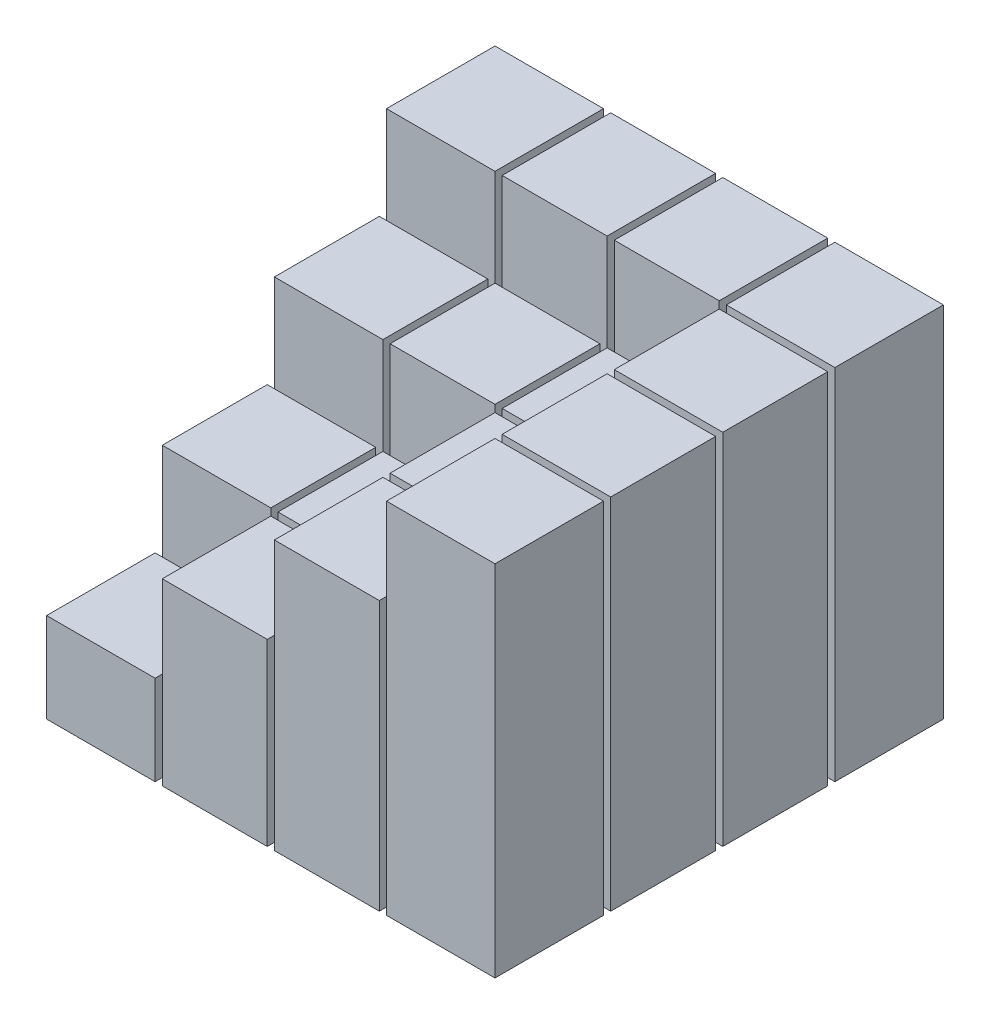
from build123d import *

# Parameters (mm, degrees)
SKETCH1_W           = 25
SKETCH1_H           = 25
BOSS_EXTRUDE1_DEPTH = 5
BOSS_EXTRUDE2_DEPTH = 10
BOSS_EXTRUDE3_DEPTH = 15
BOSS_EXTRUDE4_DEPTH = 20
SKETCH3_W           = 5.85
SKETCH3_H           = 5.85
CUT_EXTRUDE1_DEPTH  = 27.69269563
SKETCH4_R           = 0.8
CUT_EXTRUDE2_DEPTH  = 4


with BuildPart() as part:
    # Sketch1 → Boss-Extrude1 (new body)
    with BuildSketch(Plane(origin=(0, 0, 0), x_dir=(1, 0, 0), z_dir=(0, 1, 0))):
        Rectangle(SKETCH1_W, SKETCH1_H)
    extrude(amount=BOSS_EXTRUDE1_DEPTH)

    # Sketch2 → Boss-Extrude2 (add)
    with BuildSketch(Plane(origin=(0, 0, 0), x_dir=(1, 0, 0), z_dir=(0, 1, 0))):
        Polygon((-12.5, -6.25), (-6.25, -6.25), (-6.25, -12.5), (12.5, -12.5), (12.5, 12.5), (-12.5, 12.5), align=None)
    extrude(amount=BOSS_EXTRUDE2_DEPTH)

    # Sketch2<3> → Boss-Extrude3 (add)
    with BuildSketch(Plane(origin=(0, 0, 0), x_dir=(1, 0, 0), z_dir=(0, 1, 0))):
        Polygon((-12.5, 0), (0, 0), (0, -12.5), (12.5, -12.5), (12.5, 12.5), (-12.5, 12.5), align=None)
    extrude(amount=BOSS_EXTRUDE3_DEPTH)

    # Sketch2<4> → Boss-Extrude4 (add)
    with BuildSketch(Plane(origin=(0, 0, 0), x_dir=(1, 0, 0), z_dir=(0, 1, 0))):
        Polygon((-12.5, 6.25), (6.25, 6.25), (6.25, -12.5), (12.5, -12.5), (12.5, 12.5), (-12.5, 12.5), align=None)
    extrude(amount=BOSS_EXTRUDE4_DEPTH)

    # Sketch3 → Cut-Extrude1 (cut, through all)
    with BuildSketch(Plane(origin=(0, 0, 0), x_dir=(1, 0, 0), z_dir=(0, 1, 0))):
        with BuildLine():
            ThreePointArc((-12.5, 0.2), (-12.7, 0), (-12.5, -0.2))
            Line((-12.5, -0.2), (-6.45, -0.2))
            Line((-6.45, -0.2), (-6.45, -6.05))
            Line((-6.45, -6.05), (-12.5, -6.05))
            ThreePointArc((-12.5, -6.05), (-12.7, -6.25), (-12.5, -6.45))
            Line((-12.5, -6.45), (-6.45, -6.45))
            Line((-6.45, -6.45), (-6.45, -12.5))
            ThreePointArc((-6.45, -12.5), (-6.25, -12.7), (-6.05, -12.5))
            Line((-6.05, -12.5), (-6.05, -6.45))
            Line((-6.05, -6.45), (-0.2, -6.45))
            Line((-0.2, -6.45), (-0.2, -12.5))
            ThreePointArc((-0.2, -12.5), (0, -12.7), (0.2, -12.5))
            Line((0.2, -12.5), (0.2, -6.45))
            Line((0.2, -6.45), (6.05, -6.45))
            Line((6.05, -6.45), (6.05, -12.5))
            ThreePointArc((6.05, -12.5), (6.25, -12.7), (6.45, -12.5))
            Line((6.45, -12.5), (6.45, -6.45))
            Line((6.45, -6.45), (12.5, -6.45))
            ThreePointArc((12.5, -6.45), (12.7, -6.25), (12.5, -6.05))
            Line((12.5, -6.05), (6.45, -6.05))
            Line((6.45, -6.05), (6.45, -0.2))
            Line((6.45, -0.2), (12.5, -0.2))
            ThreePointArc((12.5, -0.2), (12.7, 0), (12.5, 0.2))
            Line((12.5, 0.2), (6.45, 0.2))
            Line((6.45, 0.2), (6.45, 6.05))
            Line((6.45, 6.05), (12.5, 6.05))
            ThreePointArc((12.5, 6.05), (12.7, 6.25), (12.5, 6.45))
            Line((12.5, 6.45), (6.45, 6.45))
            Line((6.45, 6.45), (6.45, 12.5))
            ThreePointArc((6.45, 12.5), (6.25, 12.7), (6.05, 12.5))
            Line((6.05, 12.5), (6.05, 6.45))
            Line((6.05, 6.45), (0.2, 6.45))
            Line((0.2, 6.45), (0.2, 12.5))
            ThreePointArc((0.2, 12.5), (0, 12.7), (-0.2, 12.5))
            Line((-0.2, 12.5), (-0.2, 6.45))
            Line((-0.2, 6.45), (-6.05, 6.45))
            Line((-6.05, 6.45), (-6.05, 12.5))
            ThreePointArc((-6.05, 12.5), (-6.25, 12.7), (-6.45, 12.5))
            Line((-6.45, 12.5), (-6.45, 6.45))
            Line((-6.45, 6.45), (-12.5, 6.45))
            ThreePointArc((-12.5, 6.45), (-12.7, 6.25), (-12.5, 6.05))
            Line((-12.5, 6.05), (-6.45, 6.05))
            Line((-6.45, 6.05), (-6.45, 0.2))
            Line((-6.45, 0.2), (-12.5, 0.2))
        make_face()
        with Locations((-3.125, -3.125)):
            Rectangle(SKETCH3_W, SKETCH3_H, mode=Mode.SUBTRACT)
        with Locations((3.125, -3.125)):
            Rectangle(SKETCH3_W, SKETCH3_H, mode=Mode.SUBTRACT)
        with Locations((-3.125, 3.125)):
            Rectangle(SKETCH3_W, SKETCH3_H, mode=Mode.SUBTRACT)
        with Locations((3.125, 3.125)):
            Rectangle(SKETCH3_W, SKETCH3_H, mode=Mode.SUBTRACT)
    extrude(amount=CUT_EXTRUDE1_DEPTH, mode=Mode.SUBTRACT)


with BuildPart() as cut_extrude1_piece_1:
    # of the separate pieces the step leaves, piece 1, a body of its own (cut_extrude1_pieces)
    add(part.part.solids().sort_by_distance((-12.5, 0, -6.45))[0])


with BuildPart() as cut_extrude1_piece_2:
    # of the separate pieces the step leaves, piece 2, a body of its own (cut_extrude1_pieces)
    add(part.part.solids().sort_by_distance((6.45, 0, -6.45))[0])


with BuildPart() as cut_extrude1_piece_3:
    # of the separate pieces the step leaves, piece 3, a body of its own (cut_extrude1_pieces)
    add(part.part.solids().sort_by_distance((6.45, 0, 12.5))[0])


with BuildPart() as cut_extrude1_piece_4:
    # of the separate pieces the step leaves, piece 4, a body of its own (cut_extrude1_pieces)
    add(part.part.solids().sort_by_distance((0.2, 0, -6.45))[0])


with BuildPart() as cut_extrude1_piece_5:
    # of the separate pieces the step leaves, piece 5, a body of its own (cut_extrude1_pieces)
    add(part.part.solids().sort_by_distance((-6.05, 0, -6.45))[0])


with BuildPart() as cut_extrude1_piece_6:
    # of the separate pieces the step leaves, piece 6, a body of its own (cut_extrude1_pieces)
    add(part.part.solids().sort_by_distance((6.45, 0, -6.05))[0])


with BuildPart() as cut_extrude1_piece_7:
    # of the separate pieces the step leaves, piece 7, a body of its own (cut_extrude1_pieces)
    add(part.part.solids().sort_by_distance((6.45, 0, 0.2))[0])


with BuildPart() as cut_extrude1_piece_8:
    # of the separate pieces the step leaves, piece 8, a body of its own (cut_extrude1_pieces)
    add(part.part.solids().sort_by_distance((0.2, 0, 12.5))[0])


with BuildPart() as cut_extrude1_piece_9:
    # of the separate pieces the step leaves, piece 9, a body of its own (cut_extrude1_pieces)
    add(part.part.solids().sort_by_distance((-12.5, 0, -0.2))[0])


with BuildPart() as cut_extrude1_piece_10:
    # of the separate pieces the step leaves, piece 10, a body of its own (cut_extrude1_pieces)
    add(part.part.solids().sort_by_distance((6.05, 0, -0.2))[0])


with BuildPart() as cut_extrude1_piece_11:
    # of the separate pieces the step leaves, piece 11, a body of its own (cut_extrude1_pieces)
    add(part.part.solids().sort_by_distance((0.2, 0, 6.05))[0])


with BuildPart() as cut_extrude1_piece_12:
    # of the separate pieces the step leaves, piece 12, a body of its own (cut_extrude1_pieces)
    add(part.part.solids().sort_by_distance((-0.2, 0, -6.05))[0])


with BuildPart() as cut_extrude1_piece_13:
    # of the separate pieces the step leaves, piece 13, a body of its own (cut_extrude1_pieces)
    add(part.part.solids().sort_by_distance((-12.5, 0, 6.05))[0])


with BuildPart() as cut_extrude1_piece_14:
    # of the separate pieces the step leaves, piece 14, a body of its own (cut_extrude1_pieces)
    add(part.part.solids().sort_by_distance((-6.05, 0, 12.5))[0])


with BuildPart() as cut_extrude1_piece_15:
    # of the separate pieces the step leaves, piece 15, a body of its own (cut_extrude1_pieces)
    add(part.part.solids().sort_by_distance((-6.05, 0, 0.2))[0])


with BuildPart() as cut_extrude1_piece_16:
    # of the separate pieces the step leaves, piece 16, a body of its own (cut_extrude1_pieces)
    add(part.part.solids().sort_by_distance((-12.5, 0, 12.5))[0])


with BuildPart() as cut_extrude2_tool:
    # Sketch4 → Cut-Extrude2 (new body)
    with BuildSketch(Plane(origin=(0, 0, 0), x_dir=(1, 0, 0), z_dir=(0, 1, 0))):
        with Locations((-9.475, -9.475)):
            Circle(SKETCH4_R)
        with Locations((-3.225, -9.475)):
            Circle(SKETCH4_R)
        with Locations((3.025, -9.475)):
            Circle(SKETCH4_R)
        with Locations((9.275, -9.475)):
            Circle(SKETCH4_R)
        with Locations((-3.225, -3.225)):
            Circle(SKETCH4_R)
        with Locations((3.025, -3.225)):
            Circle(SKETCH4_R)
        with Locations((9.275, -3.225)):
            Circle(SKETCH4_R)
        with Locations((-3.225, 3.025)):
            Circle(SKETCH4_R)
        with Locations((3.025, 3.025)):
            Circle(SKETCH4_R)
        with Locations((9.275, 3.025)):
            Circle(SKETCH4_R)
        with Locations((-3.225, 9.275)):
            Circle(SKETCH4_R)
        with Locations((3.025, 9.275)):
            Circle(SKETCH4_R)
        with Locations((9.275, 9.275)):
            Circle(SKETCH4_R)
        with Locations((-9.475, -3.225)):
            Circle(SKETCH4_R)
        with Locations((-9.475, 3.025)):
            Circle(SKETCH4_R)
        with Locations((-9.475, 9.275)):
            Circle(SKETCH4_R)
    extrude(amount=CUT_EXTRUDE2_DEPTH)


with BuildPart() as cut_extrude1_piece_1_1:
    add(cut_extrude1_piece_1.part)

    # Cut-Extrude2: cut by cut_extrude2_tool
    add(cut_extrude2_tool.part, mode=Mode.SUBTRACT)


with BuildPart() as cut_extrude1_piece_2_1:
    add(cut_extrude1_piece_2.part)

    # Cut-Extrude2: cut by cut_extrude2_tool
    add(cut_extrude2_tool.part, mode=Mode.SUBTRACT)


with BuildPart() as cut_extrude1_piece_3_1:
    add(cut_extrude1_piece_3.part)

    # Cut-Extrude2: cut by cut_extrude2_tool
    add(cut_extrude2_tool.part, mode=Mode.SUBTRACT)


with BuildPart() as cut_extrude1_piece_4_1:
    add(cut_extrude1_piece_4.part)

    # Cut-Extrude2: cut by cut_extrude2_tool
    add(cut_extrude2_tool.part, mode=Mode.SUBTRACT)


with BuildPart() as cut_extrude1_piece_5_1:
    add(cut_extrude1_piece_5.part)

    # Cut-Extrude2: cut by cut_extrude2_tool
    add(cut_extrude2_tool.part, mode=Mode.SUBTRACT)


with BuildPart() as cut_extrude1_piece_6_1:
    add(cut_extrude1_piece_6.part)

    # Cut-Extrude2: cut by cut_extrude2_tool
    add(cut_extrude2_tool.part, mode=Mode.SUBTRACT)


with BuildPart() as cut_extrude1_piece_7_1:
    add(cut_extrude1_piece_7.part)

    # Cut-Extrude2: cut by cut_extrude2_tool
    add(cut_extrude2_tool.part, mode=Mode.SUBTRACT)


with BuildPart() as cut_extrude1_piece_8_1:
    add(cut_extrude1_piece_8.part)

    # Cut-Extrude2: cut by cut_extrude2_tool
    add(cut_extrude2_tool.part, mode=Mode.SUBTRACT)


with BuildPart() as cut_extrude1_piece_9_1:
    add(cut_extrude1_piece_9.part)

    # Cut-Extrude2: cut by cut_extrude2_tool
    add(cut_extrude2_tool.part, mode=Mode.SUBTRACT)


with BuildPart() as cut_extrude1_piece_10_1:
    add(cut_extrude1_piece_10.part)

    # Cut-Extrude2: cut by cut_extrude2_tool
    add(cut_extrude2_tool.part, mode=Mode.SUBTRACT)


with BuildPart() as cut_extrude1_piece_11_1:
    add(cut_extrude1_piece_11.part)

    # Cut-Extrude2: cut by cut_extrude2_tool
    add(cut_extrude2_tool.part, mode=Mode.SUBTRACT)


with BuildPart() as cut_extrude1_piece_12_1:
    add(cut_extrude1_piece_12.part)

    # Cut-Extrude2: cut by cut_extrude2_tool
    add(cut_extrude2_tool.part, mode=Mode.SUBTRACT)


with BuildPart() as cut_extrude1_piece_13_1:
    add(cut_extrude1_piece_13.part)

    # Cut-Extrude2: cut by cut_extrude2_tool
    add(cut_extrude2_tool.part, mode=Mode.SUBTRACT)


with BuildPart() as cut_extrude1_piece_14_1:
    add(cut_extrude1_piece_14.part)

    # Cut-Extrude2: cut by cut_extrude2_tool
    add(cut_extrude2_tool.part, mode=Mode.SUBTRACT)


with BuildPart() as cut_extrude1_piece_15_1:
    add(cut_extrude1_piece_15.part)

    # Cut-Extrude2: cut by cut_extrude2_tool
    add(cut_extrude2_tool.part, mode=Mode.SUBTRACT)


with BuildPart() as cut_extrude1_piece_16_1:
    add(cut_extrude1_piece_16.part)

    # Cut-Extrude2: cut by cut_extrude2_tool
    add(cut_extrude2_tool.part, mode=Mode.SUBTRACT)


solid = Compound([cut_extrude1_piece_1_1.part, cut_extrude1_piece_2_1.part, cut_extrude1_piece_3_1.part, cut_extrude1_piece_4_1.part, cut_extrude1_piece_5_1.part, cut_extrude1_piece_6_1.part, cut_extrude1_piece_7_1.part, cut_extrude1_piece_8_1.part, cut_extrude1_piece_9_1.part, cut_extrude1_piece_10_1.part, cut_extrude1_piece_11_1.part, cut_extrude1_piece_12_1.part, cut_extrude1_piece_13_1.part, cut_extrude1_piece_14_1.part, cut_extrude1_piece_15_1.part, cut_extrude1_piece_16_1.part])
